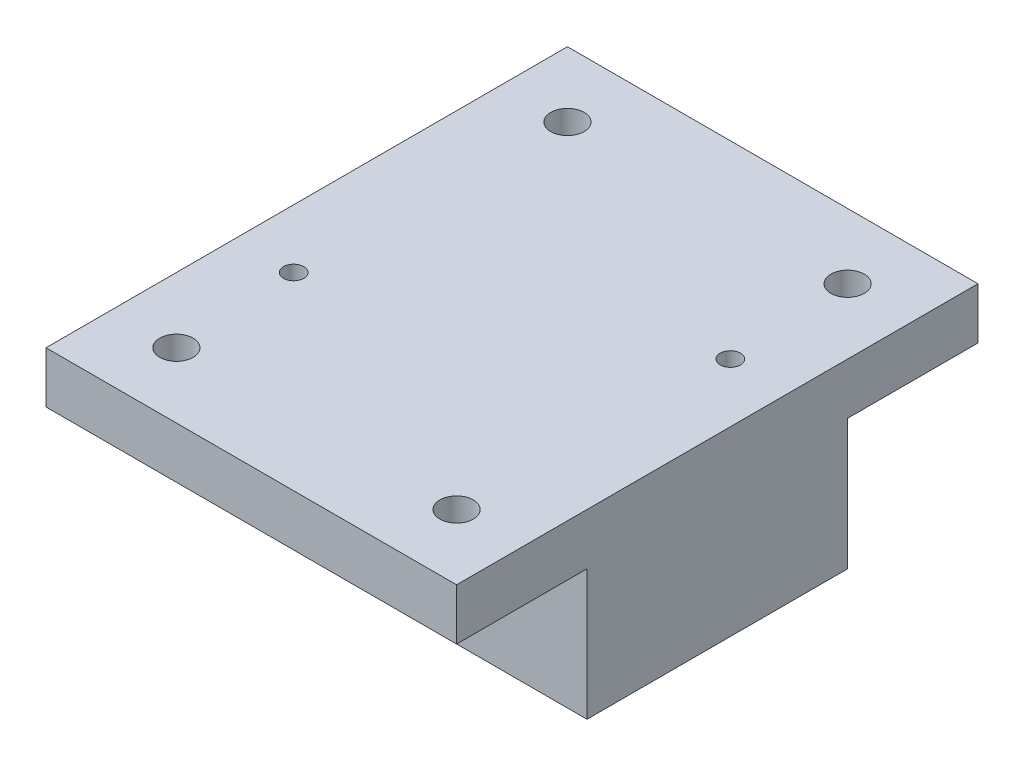
from build123d import *

# Parameters (mm, degrees)
SKETCH1_W           = 80
SKETCH1_H           = 101.6
SKETCH1_R           = 3.25
BOSS_EXTRUDE1_DEPTH = 10
SKETCH1_3_W         = 80
SKETCH1_3_H         = 50.78
BOSS_EXTRUDE2_DEPTH = 25.4
SKETCH2_R           = 1.985
CUT_EXTRUDE1_DEPTH  = 74.7143134


with BuildPart() as part:
    # Sketch1 → Boss-Extrude1 (new body)
    with BuildSketch(Plane(origin=(0, 0, 0), x_dir=(1, 0, 0), z_dir=(0, 1, 0))):
        Rectangle(SKETCH1_W, SKETCH1_H)
        with Locations((27.295, 38.095)):
            Circle(SKETCH1_R, mode=Mode.SUBTRACT)
        with Locations((-27.295, 38.095)):
            Circle(SKETCH1_R, mode=Mode.SUBTRACT)
        with Locations((27.295, -38.095)):
            Circle(SKETCH1_R, mode=Mode.SUBTRACT)
        with Locations((-27.295, -38.095)):
            Circle(SKETCH1_R, mode=Mode.SUBTRACT)
    extrude(amount=BOSS_EXTRUDE1_DEPTH)

    # Sketch1<3> → Boss-Extrude2 (add)
    with BuildSketch(Plane(origin=(0, 0, 0), x_dir=(1, 0, 0), z_dir=(0, 1, 0))):
        Rectangle(SKETCH1_3_W, SKETCH1_3_H)
    extrude(amount=-BOSS_EXTRUDE2_DEPTH)

    # Sketch2 → Cut-Extrude1 (cut, through all)
    with BuildSketch(Plane(origin=(0, 10, 0), x_dir=(1, 0, 0), z_dir=(0, 1, 0))):
        with Locations((-28.575, -13.97)):
            Circle(SKETCH2_R)
        with Locations((28.575, 13.97)):
            Circle(SKETCH2_R)
    extrude(amount=-CUT_EXTRUDE1_DEPTH, mode=Mode.SUBTRACT)


solid = part.part
